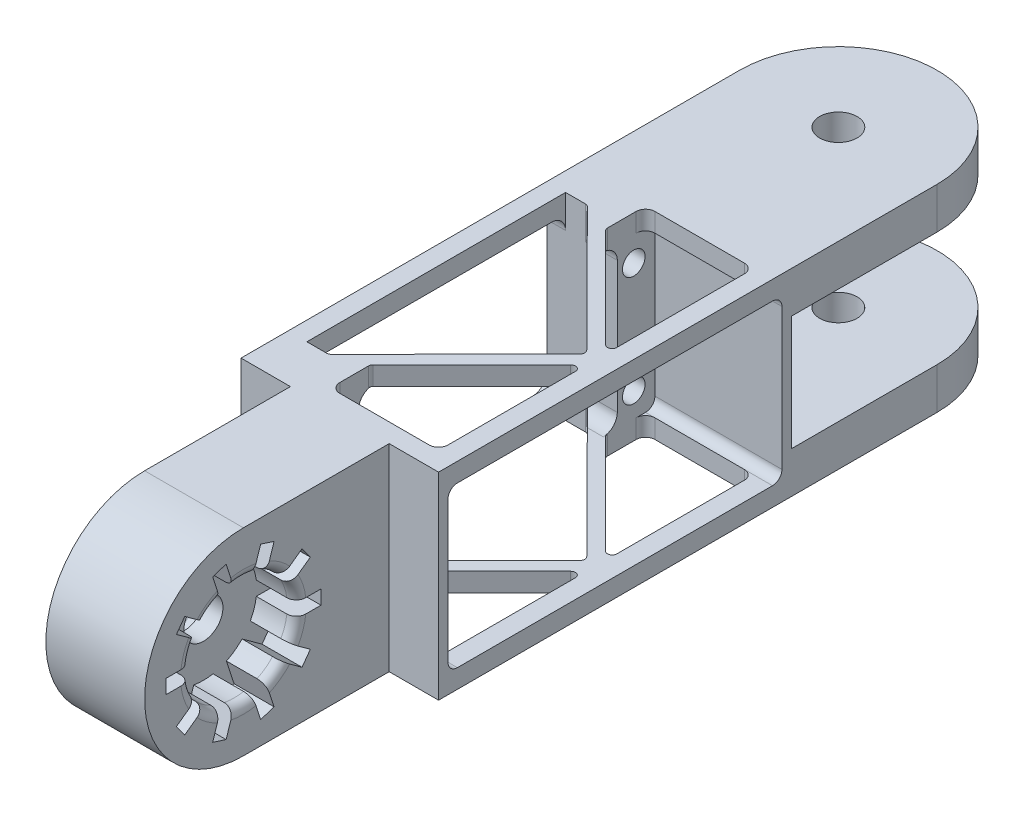
from build123d import *
from build123d.topology import SkipClean

# Parameters (mm, degrees)
SKETCH1_W           = 42
SKETCH1_H           = 42
BOSS_EXTRUDE1_DEPTH = 75
CUT_EXTRUDE1_DEPTH  = 27
CUT_EXTRUDE2_DEPTH  = 27
SKETCH4_R           = 2.4
CUT_EXTRUDE3_DEPTH  = 27
CUT_EXTRUDE5_DEPTH  = 54
CUT_EXTRUDE6_DEPTH  = 54
SKETCH10_W          = 21
SKETCH10_H          = 42
BOSS_EXTRUDE2_DEPTH = 31
BOSS_EXTRUDE3_DEPTH = 21
SKETCH12_R          = 11.35
CUT_EXTRUDE7_DEPTH  = 8.5
FILLET2_R           = 2
SKETCH13_W          = 33
SKETCH13_H          = 3
CUT_EXTRUDE8_DEPTH  = 8.5
CIRPATTERN1_COUNT   = 5
MIRROR3_START       = 23
MIRROR3_2_DEPTH     = 8.5
SKETCH15_R          = 4.15
CUT_EXTRUDE9_DEPTH  = 50
SKETCH16_W          = 42
SKETCH16_H          = 8.8
BOSS_EXTRUDE4_DEPTH = 31
BOSS_EXTRUDE5_START = -8.8
BOSS_EXTRUDE5_DEPTH = 8.8
SKETCH18_R          = 3.975
CUT_EXTRUDE10_DEPTH = 8.8
MIRROR11_DEPTH      = 8.8
MIRROR11_2_DEPTH    = 33.2
MIRROR11_START      = 8.8
MIRROR11_3_DEPTH    = 24.4
SKETCH19_W          = 47.63411802
SKETCH19_H          = 24.4
CUT_EXTRUDE11_DEPTH = 87


with BuildPart() as part:
    # Sketch1 → Boss-Extrude1 (new body)
    with BuildSketch(Plane.XY):
        with Locations((21, 21)):
            Rectangle(SKETCH1_W, SKETCH1_H)
    extrude(amount=BOSS_EXTRUDE1_DEPTH)

    # Sketch2 → Cut-Extrude1 (cut)
    with BuildSketch(Plane(origin=(42, 0, 0), x_dir=(0, 0, -1), z_dir=(1, 0, 0))):
        with BuildLine():
            Line((-71, 4), (-4, 4))
            ThreePointArc((-4, 4), (-2.585786438, 4.585786438), (-2, 6))
            Line((-2, 6), (-2, 36))
            ThreePointArc((-2, 36), (-2.585786438, 37.414213562), (-4, 38))
            Line((-4, 38), (-71, 38))
            ThreePointArc((-71, 38), (-72.414213562, 37.414213562), (-73, 36))
            Line((-73, 36), (-73, 6))
            ThreePointArc((-73, 6), (-72.414213562, 4.585786438), (-71, 4))
        make_face()
    extrude(amount=-CUT_EXTRUDE1_DEPTH, mode=Mode.SUBTRACT)

    # Sketch3 → Cut-Extrude2 (cut)
    with BuildSketch(Plane(origin=(15, 0, 0), x_dir=(0, 0, -1), z_dir=(1, 0, 0))):
        with BuildLine():
            Line((-62, 4), (-13, 4))
            ThreePointArc((-13, 4), (-10.878679656, 4.878679656), (-10, 7))
            Line((-10, 7), (-10, 35))
            ThreePointArc((-10, 35), (-10.878679656, 37.121320344), (-13, 38))
            Line((-13, 38), (-62, 38))
            ThreePointArc((-62, 38), (-64.121320344, 37.121320344), (-65, 35))
            Line((-65, 35), (-65, 7))
            ThreePointArc((-65, 7), (-64.121320344, 4.878679656), (-62, 4))
        make_face()
    extrude(amount=-CUT_EXTRUDE2_DEPTH, mode=Mode.SUBTRACT)

    # Sketch4 → Cut-Extrude3 (cut)
    with BuildSketch(Plane(origin=(15, 0, 0), x_dir=(0, 0, -1), z_dir=(1, 0, 0))):
        with Locations((-68.5, 32.75)):
            Circle(SKETCH4_R)
        with Locations((-68.5, 9.25)):
            Circle(SKETCH4_R)
        with Locations((-6.5, 32.75)):
            Circle(SKETCH4_R)
        with Locations((-6.5, 9.25)):
            Circle(SKETCH4_R)
    extrude(amount=-CUT_EXTRUDE3_DEPTH, mode=Mode.SUBTRACT)

    # Sketch8 → Cut-Extrude5 (cut)
    with BuildSketch(Plane(origin=(0, 42, 0), x_dir=(1, 0, 0), z_dir=(0, 1, 0))):
        with BuildLine():
            Line((4, -65), (4, -10))
            Line((4, -10), (8.222747049, -10))
            ThreePointArc((8.222747049, -10), (8.606595848, -10.07660404), (8.931635911, -10.294679802))
            Line((8.931635911, -10.294679802), (35.298230502, -36.794679802))
            ThreePointArc((35.298230502, -36.794679802), (35.589341639, -37.5), (35.298230502, -38.205320198))
            Line((35.298230502, -38.205320198), (8.931635911, -64.705320198))
            ThreePointArc((8.931635911, -64.705320198), (8.606595848, -64.92339596), (8.222747049, -65))
            Line((8.222747049, -65), (4, -65))
        make_face()
    extrude(amount=-CUT_EXTRUDE5_DEPTH, mode=Mode.SUBTRACT)

    # Sketch9 → Cut-Extrude6 (cut)
    with BuildSketch(Plane(origin=(0, 42, 0), x_dir=(1, 0, 0), z_dir=(0, 1, 0))):
        with BuildLine():
            Line((36, -4), (17, -4))
            ThreePointArc((17, -4), (15.585786438, -4.585786438), (15, -6))
            Line((15, -6), (15, -12.085786438))
            ThreePointArc((15, -12.085786438), (15.076120467, -12.46846987), (15.292893219, -12.792893219))
            Line((15.292893219, -12.792893219), (36.292893219, -33.792893219))
            ThreePointArc((36.292893219, -33.792893219), (37.382683432, -34.00966597), (38, -33.085786438))
            Line((38, -33.085786438), (38, -6))
            ThreePointArc((38, -6), (37.414213562, -4.585786438), (36, -4))
        make_face()
        with BuildLine():
            Line((15.292893219, -62.207106781), (36.292893219, -41.207106781))
            ThreePointArc((36.292893219, -41.207106781), (37.382683432, -40.99033403), (38, -41.914213562))
            Line((38, -41.914213562), (38, -69))
            ThreePointArc((38, -69), (37.414213562, -70.414213562), (36, -71))
            Line((36, -71), (17, -71))
            ThreePointArc((17, -71), (15.585786438, -70.414213562), (15, -69))
            Line((15, -69), (15, -62.914213562))
            ThreePointArc((15, -62.914213562), (15.076120467, -62.53153013), (15.292893219, -62.207106781))
        make_face()
    extrude(amount=-CUT_EXTRUDE6_DEPTH, mode=Mode.SUBTRACT)

    # Sketch10 → Boss-Extrude2 (add)
    with BuildSketch(Plane.XY.offset(75)):
        with Locations((21, 21)):
            Rectangle(SKETCH10_W, SKETCH10_H)
    extrude(amount=BOSS_EXTRUDE2_DEPTH)

    # Sketch11 → Boss-Extrude3 (add)
    with BuildSketch(Plane.ZY.offset(-10.5)):
        with BuildLine():
            Line((106, 0), (106, 42))
            ThreePointArc((106, 42), (127, 21), (106, 0))
        make_face()
    extrude(amount=-BOSS_EXTRUDE3_DEPTH)

    # Sketch12 → Cut-Extrude7 (cut)
    with BuildSketch(Plane.ZY.offset(-10.5)):
        with Locations((106, 21)):
            Circle(SKETCH12_R)
    extrude(amount=-CUT_EXTRUDE7_DEPTH, mode=Mode.SUBTRACT)

    # Fillet2
    fillet2_edges = [part.edges().sort_by_distance(p)[0] for p in [
        (10.5, 21, 94.65),
    ]]
    fillet(fillet2_edges, radius=FILLET2_R)

    # Sketch13 → Cut-Extrude8 (cut)
    with BuildSketch(Plane.ZY.offset(-10.5)):
        with Locations((106, 21)):
            Rectangle(SKETCH13_W, SKETCH13_H)
    cut_extrude8 = extrude(amount=-CUT_EXTRUDE8_DEPTH, mode=Mode.SUBTRACT)

    # CirPattern1: Cut-Extrude8 ×5 about axis
    cirpattern1_axis = Axis((0, 21, 106), (1, 0, 0))
    for i in range(1, CIRPATTERN1_COUNT):
        add(cut_extrude8.rotate(cirpattern1_axis, i * 360 / CIRPATTERN1_COUNT), mode=Mode.SUBTRACT)

    # Mirror3: read off the stored shape, not the designer's step
    # Mirror3 outline → Mirror3 (revolve, cut)
    with BuildSketch(Plane(origin=(0, 21, 106), x_dir=(0, 1, 0), z_dir=(0, 0, -1))):
        with BuildLine():
            Line((0, 23), (11.35, 23))
            Line((11.35, 23), (11.35, 29.5))
            ThreePointArc((11.35, 29.5), (11.935786438, 30.914213562), (13.35, 31.5))
            Line((13.35, 31.5), (0, 31.5))
            Line((0, 31.5), (0, 23))
        make_face()
    revolve(axis=Axis((0, 21, 106), (1, 0, 0)), mode=Mode.SUBTRACT)

    # Mirror3 2 outline → Mirror3 2 (cut)
    with BuildSketch(Plane.YZ.offset(MIRROR3_START)):
        with BuildLine():
            Line((22.5, 117.250444436), (22.5, 122.5))
            Line((22.5, 122.5), (19.5, 122.5))
            Line((19.5, 122.5), (19.5, 117.250444436))
            ThreePointArc((19.5, 117.250444436), (21, 117.35), (22.5, 117.250444436))
        make_face()
        with BuildLine():
            Line((29.484931171, 120.230458286), (26.399319829, 115.983478621))
            ThreePointArc((26.399319829, 115.983478621), (27.671362614, 115.182342886), (28.826370813, 114.220122864))
            Line((28.826370813, 114.220122864), (31.911982154, 118.467102529))
            Line((31.911982154, 118.467102529), (29.484931171, 120.230458286))
        make_face()
        with BuildLine():
            ThreePointArc((13.173629187, 114.220122864), (14.328637386, 115.182342886), (15.600680171, 115.983478621))
            Line((15.600680171, 115.983478621), (12.515068829, 120.230458286))
            Line((12.515068829, 120.230458286), (10.088017846, 118.467102529))
            Line((10.088017846, 118.467102529), (13.173629187, 114.220122864))
        make_face()
        with BuildLine():
            Line((36.228907027, 112.525365182), (31.236283, 110.903163299))
            ThreePointArc((31.236283, 110.903163299), (31.79449146, 109.507342886), (32.163333983, 108.04999375))
            Line((32.163333983, 108.04999375), (37.15595801, 109.672195633))
            Line((37.15595801, 109.672195633), (36.228907027, 112.525365182))
        make_face()
        with BuildLine():
            ThreePointArc((9.836666017, 108.04999375), (10.20550854, 109.507342886), (10.763717, 110.903163299))
            Line((10.763717, 110.903163299), (5.771092973, 112.525365182))
            Line((5.771092973, 112.525365182), (4.84404199, 109.672195633))
            Line((4.84404199, 109.672195633), (9.836666017, 108.04999375))
        make_face()
        with BuildLine():
            Line((37.15595801, 102.327804367), (32.163333983, 103.95000625))
            ThreePointArc((32.163333983, 103.95000625), (31.79449146, 102.492657114), (31.236283, 101.096836701))
            Line((31.236283, 101.096836701), (36.228907027, 99.474634818))
            Line((36.228907027, 99.474634818), (37.15595801, 102.327804367))
        make_face()
        with BuildLine():
            ThreePointArc((10.763717, 101.096836701), (10.20550854, 102.492657114), (9.836666017, 103.95000625))
            Line((9.836666017, 103.95000625), (4.84404199, 102.327804367))
            Line((4.84404199, 102.327804367), (5.771092973, 99.474634818))
            Line((5.771092973, 99.474634818), (10.763717, 101.096836701))
        make_face()
        with BuildLine():
            Line((31.911982154, 93.532897471), (28.826370813, 97.779877136))
            ThreePointArc((28.826370813, 97.779877136), (27.671362614, 96.817657114), (26.399319829, 96.016521379))
            Line((26.399319829, 96.016521379), (29.484931171, 91.769541714))
            Line((29.484931171, 91.769541714), (31.911982154, 93.532897471))
        make_face()
        with BuildLine():
            ThreePointArc((15.600680171, 96.016521379), (14.328637386, 96.817657114), (13.173629187, 97.779877136))
            Line((13.173629187, 97.779877136), (10.088017846, 93.532897471))
            Line((10.088017846, 93.532897471), (12.515068829, 91.769541714))
            Line((12.515068829, 91.769541714), (15.600680171, 96.016521379))
        make_face()
        with BuildLine():
            Line((22.5, 89.5), (22.5, 94.749555564))
            ThreePointArc((22.5, 94.749555564), (21, 94.65), (19.5, 94.749555564))
            Line((19.5, 94.749555564), (19.5, 89.5))
            Line((19.5, 89.5), (22.5, 89.5))
        make_face()
    extrude(amount=MIRROR3_2_DEPTH, mode=Mode.SUBTRACT)

    # Sketch15 → Cut-Extrude9 (cut)
    with BuildSketch(Plane(origin=(23, 0, 0), x_dir=(0, 0, -1), z_dir=(1, 0, 0))):
        with Locations((-106, 21)):
            Circle(SKETCH15_R)
    extrude(amount=-CUT_EXTRUDE9_DEPTH, mode=Mode.SUBTRACT)

    # Sketch16 → Boss-Extrude4 (add)
    with BuildSketch(Plane(origin=(0, 0, 0), x_dir=(-1, 0, 0), z_dir=(0, 0, -1))):
        with Locations((-21, 37.6)):
            Rectangle(SKETCH16_W, SKETCH16_H)
    boss_extrude4 = extrude(amount=BOSS_EXTRUDE4_DEPTH)

    # Sketch17 → Boss-Extrude5 (add)
    with BuildSketch(Plane(origin=(0, 42, 0), x_dir=(1, 0, 0), z_dir=(0, 1, 0)).offset(BOSS_EXTRUDE5_START)):
        with BuildLine():
            Line((0, 31), (42, 31))
            ThreePointArc((42, 31), (21, 52), (0, 31))
        make_face()
    extrude(amount=BOSS_EXTRUDE5_DEPTH)

    # Sketch18 → Cut-Extrude10 (cut)
    with BuildSketch(Plane(origin=(0, 42, 0), x_dir=(1, 0, 0), z_dir=(0, 1, 0))):
        with Locations(Location((21, 31, 0), (0, 0, 270))):
            Circle(SKETCH18_R)
    extrude(amount=-CUT_EXTRUDE10_DEPTH, mode=Mode.SUBTRACT)

    # Mirror10: Boss-Extrude4 across plane
    add(boss_extrude4.mirror(Plane.ZX.offset(21)))

    # Mirror11: read off the stored shape, not the designer's step
    # Mirror11 outline → Mirror11 (cut)
    with BuildSketch(Plane(origin=(0, 0, 0), x_dir=(1, 0, 0), z_dir=(0, 1, 0))):
        with BuildLine():
            ThreePointArc((17.025, 31), (21, 27.025), (24.975, 31))
            Line((24.975, 31), (17.025, 31))
        make_face()
    extrude(amount=MIRROR11_DEPTH, mode=Mode.SUBTRACT)

    # Mirror11 2 outline → Mirror11 2 (add)
    with SkipClean():  # the faces are left unmerged after this step: merging them gives an invalid solid
        with BuildSketch(Plane(origin=(0, 0, 0), x_dir=(1, 0, 0), z_dir=(0, 1, 0))):
            with BuildLine():
                Line((24.975, 31), (42, 31))
                ThreePointArc((42, 31), (21, 52), (0, 31))
                Line((0, 31), (17.025, 31))
                ThreePointArc((17.025, 31), (21, 34.975), (24.975, 31))
            make_face()
        extrude(amount=MIRROR11_2_DEPTH)

    # Mirror11 3 outline → Mirror11 3 (add)
    with BuildSketch(Plane(origin=(0, 0, 0), x_dir=(1, 0, 0), z_dir=(0, 1, 0)).offset(MIRROR11_START)):
        with BuildLine():
            Line((17.025, 31), (24.975, 31))
            ThreePointArc((24.975, 31), (21, 34.975), (17.025, 31))
        make_face()
    extrude(amount=MIRROR11_3_DEPTH)

    # Sketch19 → Cut-Extrude11 (cut)
    with BuildSketch(Plane(origin=(52, 0, 0), x_dir=(0, 0, -1), z_dir=(1, 0, 0))):
        with Locations((31, 21)):
            Rectangle(SKETCH19_W, SKETCH19_H)
    extrude(amount=-CUT_EXTRUDE11_DEPTH, mode=Mode.SUBTRACT)


solid = part.part
